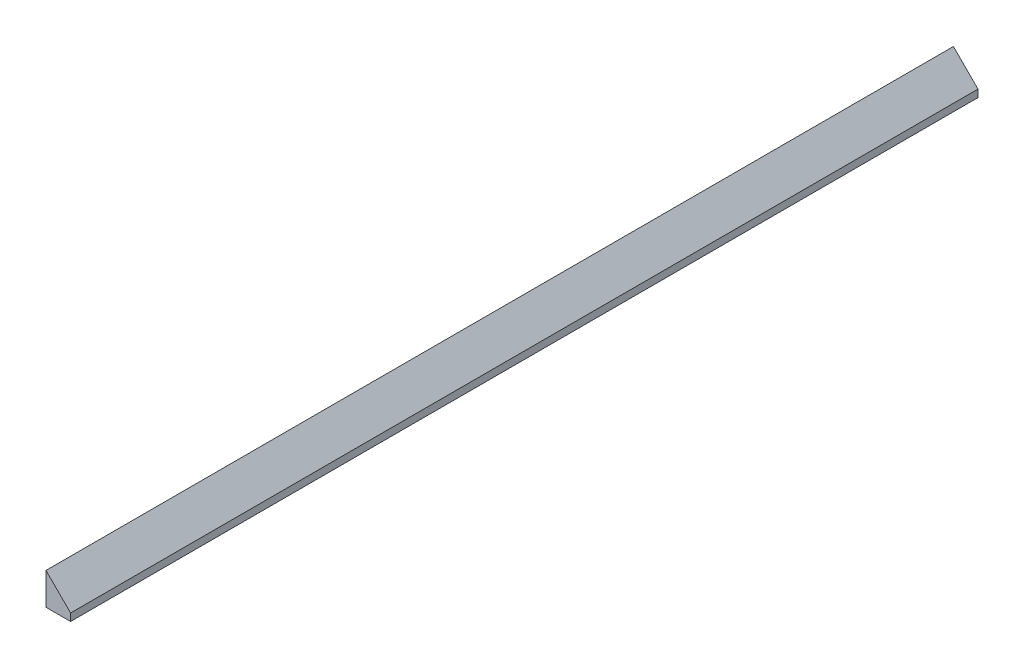
from build123d import *

# Parameters (mm, degrees)
BOSS_EXTRUDE1_DEPTH = 36.9


with BuildPart() as part:
    # Sketch1 → Boss-Extrude1 (new, symmetric)
    with BuildSketch(Plane.XY):
        Polygon((0, 2.6), (0, 0), (2, 0), (2, 0.6), align=None)
    extrude(amount=BOSS_EXTRUDE1_DEPTH, both=True)


solid = part.part
